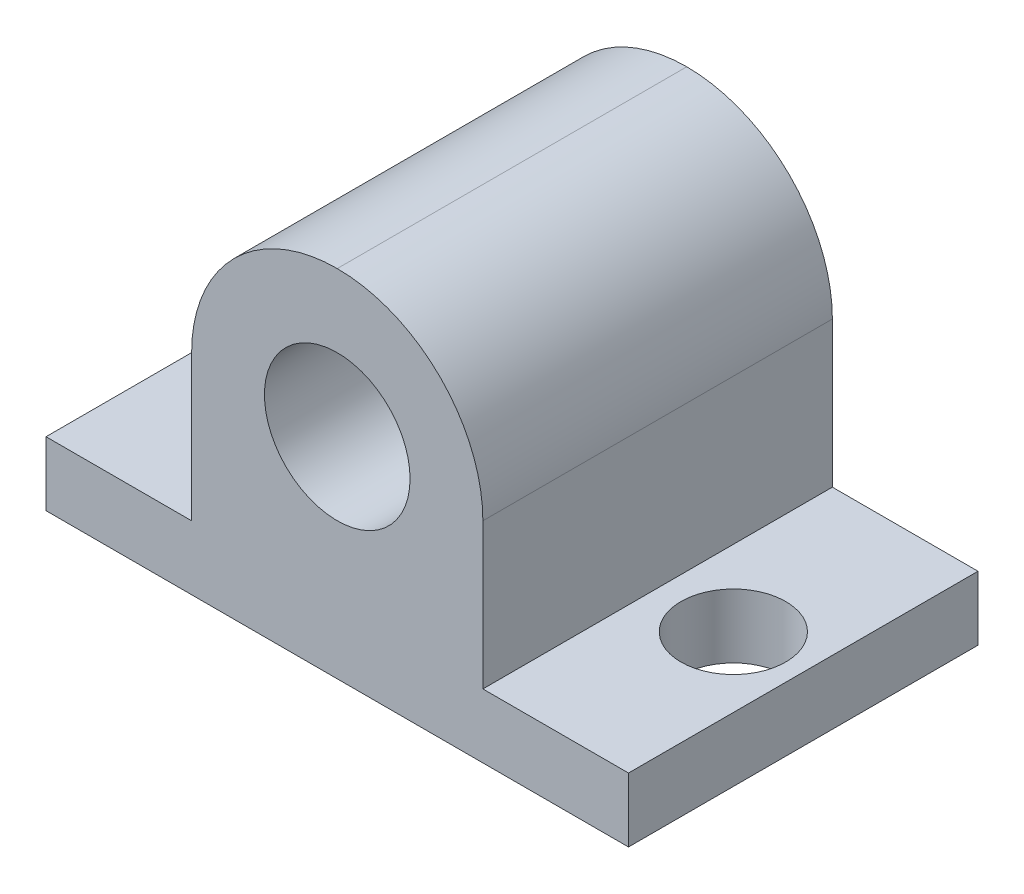
from build123d import *

# Parameters (mm, degrees)
SKETCH1_W           = 25.4
SKETCH1_H           = 15.24
BOSS_EXTRUDE1_DEPTH = 2.794
SKETCH2_W           = 12.7
SKETCH2_H           = 15.24
BOSS_EXTRUDE2_DEPTH = 12.7
FILLET1_R           = 6.35
SKETCH3_R           = 3.175
CUT_EXTRUDE1_DEPTH  = 34.428754628
SKETCH4_R           = 2.286
CUT_EXTRUDE2_DEPTH  = 33.228986953


with BuildPart() as part:
    # Sketch1 → Boss-Extrude1 (new body)
    with BuildSketch(Plane(origin=(0, 0, 0), x_dir=(1, 0, 0), z_dir=(0, 1, 0))):
        with Locations((12.7, 7.62)):
            Rectangle(SKETCH1_W, SKETCH1_H)
    extrude(amount=BOSS_EXTRUDE1_DEPTH)

    # Sketch2 → Boss-Extrude2 (add)
    with BuildSketch(Plane(origin=(0, 2.794, 0), x_dir=(1, 0, 0), z_dir=(0, 1, 0))):
        with Locations((12.7, 7.62)):
            Rectangle(SKETCH2_W, SKETCH2_H)
    extrude(amount=BOSS_EXTRUDE2_DEPTH)

    # Fillet1
    fillet1_edges = [part.edges().sort_by_distance(p)[0] for p in [
        (6.35, 15.494, -7.62),
        (19.05, 15.494, -7.62),
    ]]
    fillet(fillet1_edges, radius=FILLET1_R - 0.0001)  # a hair under: the kernel refuses the full size

    # Sketch3 → Cut-Extrude1 (cut, through all)
    with BuildSketch(Plane.XY):
        with Locations((12.7, 9.144)):
            Circle(SKETCH3_R)
    extrude(amount=-CUT_EXTRUDE1_DEPTH, mode=Mode.SUBTRACT)

    # Sketch4 → Cut-Extrude2 (cut, through all)
    with BuildSketch(Plane(origin=(0, 2.794, 0), x_dir=(1, 0, 0), z_dir=(0, 1, 0))):
        with Locations(Location((3.048, 7.62, 0), (0, 0, 270))):
            Circle(SKETCH4_R)
        with Locations(Location((22.352, 7.62, 0), (0, 0, 270))):
            Circle(SKETCH4_R)
    extrude(amount=-CUT_EXTRUDE2_DEPTH, mode=Mode.SUBTRACT)


solid = part.part
